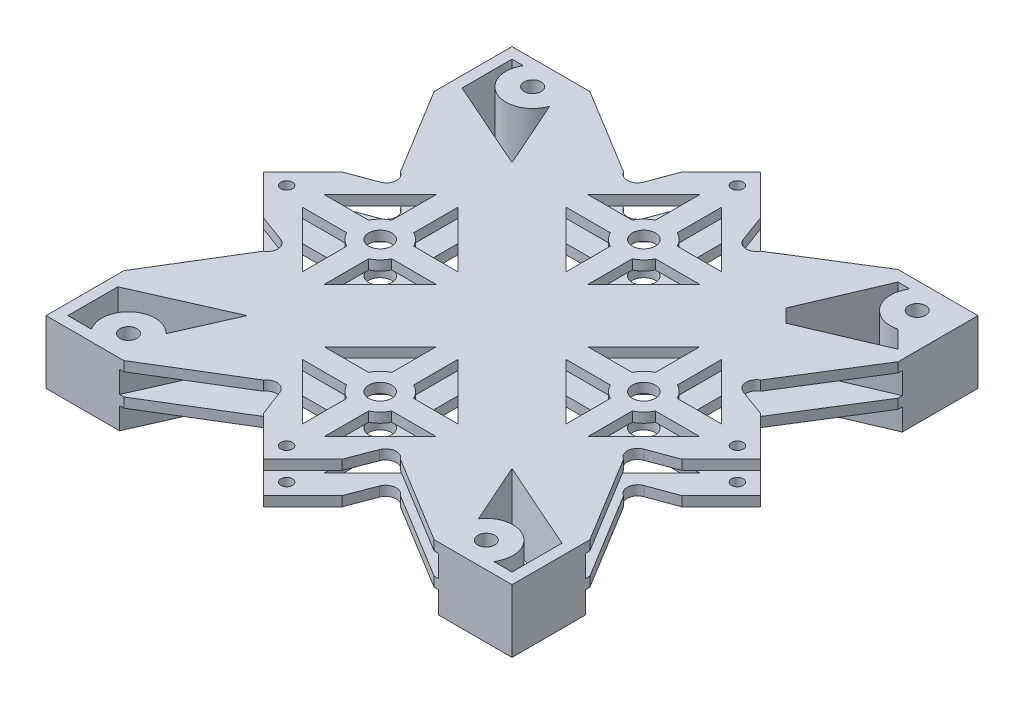
from build123d import *
from build123d.topology import SkipClean

# Parameters (mm, degrees)
SKETCH1_W            = 97.6
SKETCH1_H            = 97.6
BOSS_EXTRUDE1_DEPTH  = 2
SKETCH3_R            = 1.25
CUT_EXTRUDE1_DEPTH   = 10
FILLET1_R            = 0.2
SKETCH5_R            = 1.25
SKETCH5_R_2          = 1.248424064
SKETCH5_R_3          = 2.375
CUT_EXTRUDE2_DEPTH   = 10
SKETCH6_W            = 104.867444639
SKETCH6_H            = 104.070743389
SKETCH6_W_2          = 97.6
SKETCH6_H_2          = 97.6
BOSS_EXTRUDE2_DEPTH  = 2
SKETCH9_W            = 104.867444639
SKETCH9_H            = 104.070743389
CUT_EXTRUDE3_DEPTH   = 2
BOSS_EXTRUDE3_START  = 4.5
SKETCH11_R           = 1.25
BOSS_EXTRUDE3_DEPTH  = 4.5
CUT_EXTRUDE4_DEPTH   = 4.5
BOSS_EXTRUDE4_DEPTH  = 2
SKETCH15_R           = 1.25
SKETCH15_R_2         = 2.375
SKETCH15_R_3         = 1.248424064
CUT_EXTRUDE5_DEPTH   = 142.810069653
BOSS_EXTRUDE10_START = 4.5
SKETCH16_R           = 1.25
BOSS_EXTRUDE10_DEPTH = 4.5
CUT_EXTRUDE6_DEPTH   = 1.85
SKETCH18_R           = 1.75
CUT_EXTRUDE7_DEPTH   = 143.150785629
BOSS_EXTRUDE11_DEPTH = 13
CUT_EXTRUDE10_DEPTH  = 11
CUT_EXTRUDE11_DEPTH  = 11
BOSS_EXTRUDE13_DEPTH = 2
SKETCH33_W           = 24.159337572
SKETCH33_H           = 13.360853571
SKETCH33_W_2         = 23.642161886
SKETCH33_H_2         = 13
CUT_EXTRUDE13_DEPTH  = 0.75
SKETCH34_W           = 20.408967788
SKETCH34_H           = 13
SKETCH34_W_2         = 21.119256586
CUT_EXTRUDE14_DEPTH  = 0.75
SKETCH35_W           = 21.001738999
SKETCH35_H           = 13
SKETCH35_W_2         = 20.166168151
CUT_EXTRUDE15_DEPTH  = 0.75
SKETCH36_W           = 19.371210598
SKETCH36_H           = 13
SKETCH36_W_2         = 18.340258541
CUT_EXTRUDE16_DEPTH  = 0.75
SKETCH38_R           = 1.25
SKETCH38_R_2         = 1.248424064
BOSS_EXTRUDE14_DEPTH = 2
SKETCH39_R           = 1.25
SKETCH39_R_2         = 1.248424064
BOSS_EXTRUDE15_DEPTH = 2
SKETCH40_R           = 1.2
CUT_EXTRUDE17_DEPTH  = 142.810069653


with BuildPart() as part:
    # Sketch1 → Boss-Extrude1 (new body)
    with BuildSketch(Plane(origin=(0, 0, 0), x_dir=(1, 0, 0), z_dir=(0, 1, 0))):
        with Locations((48.8, 48.8)):
            Rectangle(SKETCH1_W, SKETCH1_H)
    extrude(amount=BOSS_EXTRUDE1_DEPTH)

    # Sketch3 → Cut-Extrude1 (cut)
    with BuildSketch(Plane.XZ):
        with BuildLine():
            Line((3, -84.3), (3, -94.6))
            Line((3, -94.6), (5.316079849, -94.6))
            ThreePointArc((5.316079849, -94.6), (7.792729855, -86.784550719), (15.285000001, -90.113353923))
            Line((15.285000001, -90.113353923), (21.472818771, -76.127181229))
            Line((21.472818771, -76.127181229), (3, -84.3))
        make_face()
        with BuildLine():
            Line((3, -13.3), (21.472818771, -21.472818771))
            Line((21.472818771, -21.472818771), (16.360495139, -9.917560959))
            ThreePointArc((16.360495139, -9.917560959), (8.975209709, -10.313312378), (7.873156109, -3))
            Line((7.873156109, -3), (3, -3))
            Line((3, -3), (3, -13.3))
        make_face()
        with BuildLine():
            Line((94.6, -13.3), (94.6, -3))
            Line((94.6, -3), (90.826843891, -3))
            ThreePointArc((90.826843891, -3), (89.267333256, -10.648445392), (81.630186258, -9.034513526))
            Line((81.630186258, -9.034513526), (76.127181229, -21.472818771))
            Line((76.127181229, -21.472818771), (94.6, -13.3))
        make_face()
        with BuildLine():
            Line((91.027327292, -86.172672708), (94.6, -82.6))
            Line((94.6, -82.6), (73.674141566, -73.674141566))
            Line((73.674141566, -73.674141566), (82.6, -94.6))
            Line((82.6, -94.6), (85.116873323, -94.6))
            ThreePointArc((85.116873323, -94.6), (85.157069093, -88.341897208), (91.027327292, -86.172672708))
        make_face()
        with Locations(Location((89.66, -91.5, 0), (0, 0, 270))):
            Circle(SKETCH3_R)
        with Locations(Location((10.05, -91.8, 0), (0, 0, 270))):
            Circle(SKETCH3_R)
        with Locations(Location((12.45, -6.05, 0), (0, 0, 270))):
            Circle(SKETCH3_R)
        with Locations(Location((86.25, -6.05, 0), (0, 0, 270))):
            Circle(SKETCH3_R)
    extrude(amount=-CUT_EXTRUDE1_DEPTH, mode=Mode.SUBTRACT)

    # Fillet1
    fillet1_edges = [part.edges().sort_by_distance(p)[0] for p in [
        (85.116873323, 1, -94.6),
    ]]
    fillet(fillet1_edges, radius=FILLET1_R)

    # Sketch5 → Cut-Extrude2 (cut)
    with BuildSketch(Plane.XZ):
        with BuildLine():
            Line((51.05, -80.617052601), (51.05, -89.767052601))
            Line((51.05, -89.767052601), (62.582493929, -78.234558673))
            Line((62.582493929, -78.234558673), (53.432493929, -78.234558673))
            ThreePointArc((53.432493929, -78.234558673), (52.441599923, -79.626158596), (51.05, -80.617052601))
        make_face()
        with BuildLine():
            Line((46.55, -89.767052601), (46.55, -80.617052601))
            ThreePointArc((46.55, -80.617052601), (45.158400077, -79.626158596), (44.167506071, -78.234558673))
            Line((44.167506071, -78.234558673), (35.017506071, -78.234558673))
            Line((35.017506071, -78.234558673), (46.55, -89.767052601))
        make_face()
        with BuildLine():
            Line((35.017506071, -73.734558673), (44.167506071, -73.734558673))
            ThreePointArc((44.167506071, -73.734558673), (45.158400077, -72.34295875), (46.55, -71.352064744))
            Line((46.55, -71.352064744), (46.55, -62.202064744))
            Line((46.55, -62.202064744), (35.017506071, -73.734558673))
        make_face()
        with BuildLine():
            ThreePointArc((51.05, -71.352064744), (52.441599923, -72.34295875), (53.432493929, -73.734558673))
            Line((53.432493929, -73.734558673), (62.582493929, -73.734558673))
            Line((62.582493929, -73.734558673), (51.05, -62.202064744))
            Line((51.05, -62.202064744), (51.05, -71.352064744))
        make_face()
        with BuildLine():
            Line((73.734558673, -35.017506071), (62.202064744, -46.55))
            Line((62.202064744, -46.55), (71.352064744, -46.55))
            ThreePointArc((71.352064744, -46.55), (72.34295875, -45.158400077), (73.734558673, -44.167506071))
            Line((73.734558673, -44.167506071), (73.734558673, -35.017506071))
        make_face()
        with BuildLine():
            ThreePointArc((73.734558673, -53.432493929), (72.34295875, -52.441599923), (71.352064744, -51.05))
            Line((71.352064744, -51.05), (62.202064744, -51.05))
            Line((62.202064744, -51.05), (73.734558673, -62.582493929))
            Line((73.734558673, -62.582493929), (73.734558673, -53.432493929))
        make_face()
        with BuildLine():
            Line((78.234558673, -35.017506071), (78.234558673, -44.167506071))
            ThreePointArc((78.234558673, -44.167506071), (79.626158596, -45.158400077), (80.617052601, -46.55))
            Line((80.617052601, -46.55), (89.767052601, -46.55))
            Line((89.767052601, -46.55), (78.234558673, -35.017506071))
        make_face()
        with BuildLine():
            ThreePointArc((80.617052601, -51.05), (79.626158596, -52.441599923), (78.234558673, -53.432493929))
            Line((78.234558673, -53.432493929), (78.234558673, -62.582493929))
            Line((78.234558673, -62.582493929), (89.767052601, -51.05))
            Line((89.767052601, -51.05), (80.617052601, -51.05))
        make_face()
        with BuildLine():
            Line((46.55, -16.982947399), (46.55, -7.832947399))
            Line((46.55, -7.832947399), (35.017506071, -19.365441327))
            Line((35.017506071, -19.365441327), (44.167506071, -19.365441327))
            ThreePointArc((44.167506071, -19.365441327), (45.158400077, -17.973841404), (46.55, -16.982947399))
        make_face()
        with BuildLine():
            Line((51.05, -7.832947399), (51.05, -16.982947399))
            ThreePointArc((51.05, -16.982947399), (52.441599923, -17.973841404), (53.432493929, -19.365441327))
            Line((53.432493929, -19.365441327), (62.582493929, -19.365441327))
            Line((62.582493929, -19.365441327), (51.05, -7.832947399))
        make_face()
        with BuildLine():
            ThreePointArc((46.55, -26.247935256), (45.158400077, -25.25704125), (44.167506071, -23.865441327))
            Line((44.167506071, -23.865441327), (35.017506071, -23.865441327))
            Line((35.017506071, -23.865441327), (46.55, -35.397935256))
            Line((46.55, -35.397935256), (46.55, -26.247935256))
        make_face()
        with BuildLine():
            Line((62.582493929, -23.865441327), (53.432493929, -23.865441327))
            ThreePointArc((53.432493929, -23.865441327), (52.441599923, -25.25704125), (51.05, -26.247935256))
            Line((51.05, -26.247935256), (51.05, -35.397935256))
            Line((51.05, -35.397935256), (62.582493929, -23.865441327))
        make_face()
        with BuildLine():
            Line((23.865441327, -62.582493929), (35.397935256, -51.05))
            Line((35.397935256, -51.05), (26.247935256, -51.05))
            ThreePointArc((26.247935256, -51.05), (25.25704125, -52.441599923), (23.865441327, -53.432493929))
            Line((23.865441327, -53.432493929), (23.865441327, -62.582493929))
        make_face()
        with BuildLine():
            Line((19.365441327, -62.582493929), (19.365441327, -53.432493929))
            ThreePointArc((19.365441327, -53.432493929), (17.973841404, -52.441599923), (16.982947399, -51.05))
            Line((16.982947399, -51.05), (7.832947399, -51.05))
            Line((7.832947399, -51.05), (19.365441327, -62.582493929))
        make_face()
        with BuildLine():
            ThreePointArc((23.865441327, -44.167506071), (25.25704125, -45.158400077), (26.247935256, -46.55))
            Line((26.247935256, -46.55), (35.397935256, -46.55))
            Line((35.397935256, -46.55), (23.865441327, -35.017506071))
            Line((23.865441327, -35.017506071), (23.865441327, -44.167506071))
        make_face()
        with BuildLine():
            Line((7.832947399, -46.55), (16.982947399, -46.55))
            ThreePointArc((16.982947399, -46.55), (17.973841404, -45.158400077), (19.365441327, -44.167506071))
            Line((19.365441327, -44.167506071), (19.365441327, -35.017506071))
            Line((19.365441327, -35.017506071), (7.832947399, -46.55))
        make_face()
        with Locations(Location((48.8, -95.854595373, 0), (0, 0, 270))):
            Circle(SKETCH5_R)
        with Locations(Location((95.84456992, -48.8, 0), (0, 0, 270))):
            Circle(SKETCH5_R_2)
        with Locations(Location((1.75, -48.8, 0), (0, 0, 270))):
            Circle(SKETCH5_R)
        with Locations(Location((48.8, -1.75, 0), (0, 0, 270))):
            Circle(SKETCH5_R)
        with Locations(Location((48.8, -75.984558673, 0), (0, 0, 270))):
            Circle(SKETCH5_R_3)
        with Locations(Location((75.984558673, -48.8, 0), (0, 0, 270))):
            Circle(SKETCH5_R_3)
        with Locations(Location((48.8, -21.615441327, 0), (0, 0, 270))):
            Circle(SKETCH5_R_3)
        with Locations(Location((21.615441327, -48.8, 0), (0, 0, 270))):
            Circle(SKETCH5_R_3)
    extrude(amount=-CUT_EXTRUDE2_DEPTH, mode=Mode.SUBTRACT)

    # Sketch6 → Boss-Extrude2 (add)
    with BuildSketch(Plane(origin=(0, 2, 0), x_dir=(1, 0, 0), z_dir=(0, 1, 0))):
        with Locations((49.842483603, 49.323375799)):
            Rectangle(SKETCH6_W, SKETCH6_H)
        with Locations((48.8, 48.8)):
            Rectangle(SKETCH6_W_2, SKETCH6_H_2, mode=Mode.SUBTRACT)
    extrude(amount=-BOSS_EXTRUDE2_DEPTH)

    # Sketch9 → Cut-Extrude3 (cut)
    # profile 1 of 9: a face of its own
    with BuildSketch(Plane(origin=(0, 2, 0), x_dir=(1, 0, 0), z_dir=(0, 1, 0))):
        with Locations((49.842483603, 49.323375799)):
            Rectangle(SKETCH9_W, SKETCH9_H)
        Polygon((81.575043976, 97.6), (97.6, 97.6), (97.6, 81.575043976), (97.6, 51.29456992), (100.09456992, 48.8), (97.6, 46.30543008), (97.6, 15.581273054), (97.6, 0), (82.018726946, 0), (51.29456992, 0), (48.8, -2.49456992), (46.30543008, 0), (15.581273054, 0), (0, 0), (0, 15.581273054), (0, 46.30543008), (-2.49456992, 48.8), (0, 51.29456992), (0, 82.018726946), (0, 97.6), (15.581273054, 97.6), (46.30543008, 97.6), (48.8, 100.09456992), (51.29456992, 97.6), align=None, mode=Mode.SUBTRACT)
    # profile 2 of 9: a face of its own
    with BuildSketch(Plane(origin=(0, 2, 0), x_dir=(1, 0, 0), z_dir=(0, 1, 0))):
        with BuildLine():
            Line((40.668272016, 91.962841937), (46.30543008, 97.6))
            Line((46.30543008, 97.6), (15.581273054, 97.6))
            Line((15.581273054, 97.6), (34.657864376, 85.952434296))
            ThreePointArc((34.657864376, 85.952434296), (36.694771141, 84.840299118), (38.55, 86.234558673))
            Line((38.55, 86.234558673), (40.668272016, 91.962841937))
        make_face()
    # profile 3 of 9: a face of its own
    with BuildSketch(Plane(origin=(0, 2, 0), x_dir=(1, 0, 0), z_dir=(0, 1, 0))):
        with BuildLine():
            Line((62.942135624, 85.952434296), (81.575043976, 97.6))
            Line((81.575043976, 97.6), (51.29456992, 97.6))
            Line((51.29456992, 97.6), (56.931727984, 91.962841937))
            Line((56.931727984, 91.962841937), (59.05, 86.234558673))
            ThreePointArc((59.05, 86.234558673), (60.905228859, 84.840299118), (62.942135624, 85.952434296))
        make_face()
    # profile 4 of 9: a face of its own
    with BuildSketch(Plane(origin=(0, 2, 0), x_dir=(1, 0, 0), z_dir=(0, 1, 0))):
        with BuildLine():
            Line((97.6, 51.29456992), (97.6, 81.575043976))
            Line((97.6, 81.575043976), (85.952434296, 62.942135624))
            ThreePointArc((85.952434296, 62.942135624), (84.840299118, 60.905228859), (86.234558673, 59.05))
            Line((86.234558673, 59.05), (91.962841937, 56.931727984))
            Line((91.962841937, 56.931727984), (97.6, 51.29456992))
        make_face()
    # profile 5 of 9: a face of its own
    with BuildSketch(Plane(origin=(0, 2, 0), x_dir=(1, 0, 0), z_dir=(0, 1, 0))):
        with BuildLine():
            Line((97.6, 15.581273054), (97.6, 46.30543008))
            Line((97.6, 46.30543008), (91.962841937, 40.668272016))
            Line((91.962841937, 40.668272016), (86.234558673, 38.55))
            ThreePointArc((86.234558673, 38.55), (84.840299118, 36.694771141), (85.952434296, 34.657864376))
            Line((85.952434296, 34.657864376), (97.6, 15.581273054))
        make_face()
    # profile 6 of 9: a face of its own
    with BuildSketch(Plane(origin=(0, 2, 0), x_dir=(1, 0, 0), z_dir=(0, 1, 0))):
        with BuildLine():
            Line((51.29456992, 0), (82.018726946, 0))
            Line((82.018726946, 0), (62.942135624, 11.647565704))
            ThreePointArc((62.942135624, 11.647565704), (60.858639354, 12.601902927), (59.05, 11.194586358))
            Line((59.05, 11.194586358), (56.931727984, 5.637158063))
            Line((56.931727984, 5.637158063), (51.29456992, 0))
        make_face()
    # profile 7 of 9: a face of its own
    with BuildSketch(Plane(origin=(0, 2, 0), x_dir=(1, 0, 0), z_dir=(0, 1, 0))):
        with BuildLine():
            Line((15.581273054, 0), (46.30543008, 0))
            Line((46.30543008, 0), (40.668272016, 5.637158063))
            Line((40.668272016, 5.637158063), (38.55, 11.194586358))
            ThreePointArc((38.55, 11.194586358), (36.741360646, 12.601902927), (34.657864376, 11.647565704))
            Line((34.657864376, 11.647565704), (15.581273054, 0))
        make_face()
    # profile 8 of 9: a face of its own
    with BuildSketch(Plane(origin=(0, 2, 0), x_dir=(1, 0, 0), z_dir=(0, 1, 0))):
        with BuildLine():
            Line((5.637158063, 40.668272016), (0, 46.30543008))
            Line((0, 46.30543008), (0, 15.581273054))
            Line((0, 15.581273054), (11.647565704, 34.657864376))
            ThreePointArc((11.647565704, 34.657864376), (12.759700882, 36.694771141), (11.365441327, 38.55))
            Line((11.365441327, 38.55), (5.637158063, 40.668272016))
        make_face()
    # profile 9 of 9: a face of its own
    with BuildSketch(Plane(origin=(0, 2, 0), x_dir=(1, 0, 0), z_dir=(0, 1, 0))):
        with BuildLine():
            Line((11.647565704, 62.942135624), (0, 82.018726946))
            Line((0, 82.018726946), (0, 51.29456992))
            Line((0, 51.29456992), (5.637158063, 56.931727984))
            Line((5.637158063, 56.931727984), (11.365441327, 59.05))
            ThreePointArc((11.365441327, 59.05), (12.759700882, 60.905228859), (11.647565704, 62.942135624))
        make_face()
    extrude(amount=-CUT_EXTRUDE3_DEPTH, mode=Mode.SUBTRACT)

    # Sketch11 → Boss-Extrude3 (add)
    # profile 1 of 9: a face of its own
    with SkipClean():  # the faces are left unmerged after this step: merging them gives an invalid solid
        with BuildSketch(Plane.XZ.offset(BOSS_EXTRUDE3_START)):
            Polygon((97.6, -97.6), (81.575043976, -97.6), (69.655336569, -69.655336569), (97.6, -81.575043976), align=None)
            with Locations(Location((89.66, -91.5, 0), (0, 0, 270))):
                Circle(SKETCH11_R, mode=Mode.SUBTRACT)
            with BuildLine():
                ThreePointArc((84.752862341, -94.6), (84.926573132, -94.499118926), (84.92504261, -94.298245614))
                ThreePointArc((84.92504261, -94.298245614), (85.26210654, -88.197193145), (91.027327292, -86.172672708))
                Line((91.027327292, -86.172672708), (94.6, -82.6))
                Line((94.6, -82.6), (73.674141566, -73.674141566))
                Line((73.674141566, -73.674141566), (82.6, -94.6))
                Line((82.6, -94.6), (84.752862341, -94.6))
            make_face(mode=Mode.SUBTRACT)
        # profile 2 of 9: a face of its own
        with BuildSketch(Plane.XZ.offset(BOSS_EXTRUDE3_START)):
            Polygon((48.8, -49.789949494), (47.810050506, -48.8), (26.169211238, -70.440839268), (27.944663431, -69.655336569), (27.159160732, -71.430788762), align=None)
        # profile 3 of 9: a face of its own
        with BuildSketch(Plane.XZ.offset(BOSS_EXTRUDE3_START)):
            Polygon((71.430788762, -27.159160732), (69.655336569, -27.944663431), (70.440839268, -26.169211238), (48.8, -47.810050506), (49.789949494, -48.8), align=None)
        # profile 4 of 9: a face of its own
        with BuildSketch(Plane.XZ.offset(BOSS_EXTRUDE3_START)):
            Polygon((47.810050506, -48.8), (48.8, -47.810050506), (27.159160732, -26.169211238), (27.944663431, -27.944663431), (26.169211238, -27.159160732), align=None)
        # profile 5 of 9: a face of its own
        with BuildSketch(Plane.XZ.offset(BOSS_EXTRUDE3_START)):
            Polygon((71.381631816, -70.391682322), (49.789949494, -48.8), (48.8, -49.789949494), (70.391682322, -71.381631816), (69.655336569, -69.655336569), align=None)
        # profile 6 of 9: a face of its own
        with BuildSketch(Plane.XZ.offset(BOSS_EXTRUDE3_START)):
            Polygon((49.789949494, -48.8), (48.8, -47.810050506), (47.810050506, -48.8), (48.8, -49.789949494), align=None)
        # profile 7 of 9: a face of its own
        with BuildSketch(Plane.XZ.offset(BOSS_EXTRUDE3_START)):
            Polygon((15.581273054, -97.6), (0, -97.6), (0, -82.018726946), (27.944663431, -69.655336569), align=None)
            with Locations(Location((10.05, -91.8, 0), (0, 0, 270))):
                Circle(SKETCH11_R, mode=Mode.SUBTRACT)
            with BuildLine():
                Line((21.472818771, -76.127181229), (15.285000001, -90.113353923))
                ThreePointArc((15.285000001, -90.113353923), (7.792729855, -86.784550719), (5.316079849, -94.6))
                Line((5.316079849, -94.6), (3, -94.6))
                Line((3, -94.6), (3, -84.3))
                Line((3, -84.3), (21.472818771, -76.127181229))
            make_face(mode=Mode.SUBTRACT)
        # profile 8 of 9: a face of its own
        with BuildSketch(Plane.XZ.offset(BOSS_EXTRUDE3_START)):
            Polygon((0, 0), (15.581273054, 0), (27.944663431, -27.944663431), (0, -15.581273054), align=None)
            with Locations(Location((12.45, -6.05, 0), (0, 0, 270))):
                Circle(SKETCH11_R, mode=Mode.SUBTRACT)
            with BuildLine():
                Line((3, -3), (7.873156109, -3))
                ThreePointArc((7.873156109, -3), (8.975209709, -10.313312378), (16.360495139, -9.917560959))
                Line((16.360495139, -9.917560959), (21.472818771, -21.472818771))
                Line((21.472818771, -21.472818771), (3, -13.3))
                Line((3, -13.3), (3, -3))
            make_face(mode=Mode.SUBTRACT)
        # profile 9 of 9: a face of its own
        with BuildSketch(Plane.XZ.offset(BOSS_EXTRUDE3_START)):
            Polygon((82.018726946, 0), (97.6, 0), (97.6, -15.581273054), (69.655336569, -27.944663431), align=None)
            with Locations(Location((86.25, -6.05, 0), (0, 0, 270))):
                Circle(SKETCH11_R, mode=Mode.SUBTRACT)
            with BuildLine():
                Line((76.127181229, -21.472818771), (81.630186258, -9.034513526))
                ThreePointArc((81.630186258, -9.034513526), (89.267333256, -10.648445392), (90.826843891, -3))
                Line((90.826843891, -3), (94.6, -3))
                Line((94.6, -3), (94.6, -13.3))
                Line((94.6, -13.3), (76.127181229, -21.472818771))
            make_face(mode=Mode.SUBTRACT)
        extrude(amount=-BOSS_EXTRUDE3_DEPTH)

    # Sketch12 → Cut-Extrude4 (cut)
    with SkipClean():  # the faces are left unmerged after this step: merging them gives an invalid solid
        with BuildSketch(Plane.XZ.offset(4.5)):
            Polygon((26.876318019, -71.14794605), (71.148273589, -26.875990479), (70.724009521, -26.451726411), (26.45205395, -70.723681981), align=None)
            Polygon((26.45205395, -26.876318019), (70.724009521, -71.148273589), (71.148273589, -70.724009521), (26.876318019, -26.45205395), align=None)
        extrude(amount=-CUT_EXTRUDE4_DEPTH, mode=Mode.SUBTRACT)

    # Sketch13 → Boss-Extrude4 (add)
    with SkipClean():  # the faces are left unmerged after this step: merging them gives an invalid solid
        with BuildSketch(Plane.XZ.offset(4.5)):
            with BuildLine():
                Line((0, -97.6), (0, -82.018726946))
                Line((0, -82.018726946), (11.647565704, -62.942135624))
                ThreePointArc((11.647565704, -62.942135624), (12.759700882, -60.905228859), (11.365441327, -59.05))
                Line((11.365441327, -59.05), (5.637158063, -56.931727984))
                Line((5.637158063, -56.931727984), (-2.49456992, -48.8))
                Line((-2.49456992, -48.8), (5.637158063, -40.668272016))
                Line((5.637158063, -40.668272016), (11.365441327, -38.55))
                ThreePointArc((11.365441327, -38.55), (12.759700882, -36.694771141), (11.647565704, -34.657864376))
                Line((11.647565704, -34.657864376), (0, -15.581273054))
                Line((0, -15.581273054), (0, 0))
                Line((0, 0), (15.581273054, 0))
                Line((15.581273054, 0), (34.657864376, -11.647565704))
                ThreePointArc((34.657864376, -11.647565704), (36.741360646, -12.601902927), (38.55, -11.194586358))
                Line((38.55, -11.194586358), (40.668272016, -5.637158063))
                Line((40.668272016, -5.637158063), (48.8, 2.49456992))
                Line((48.8, 2.49456992), (56.931727984, -5.637158063))
                Line((56.931727984, -5.637158063), (59.05, -11.194586358))
                ThreePointArc((59.05, -11.194586358), (60.858639354, -12.601902927), (62.942135624, -11.647565704))
                Line((62.942135624, -11.647565704), (82.018726946, 0))
                Line((82.018726946, 0), (97.6, 0))
                Line((97.6, 0), (97.6, -15.581273054))
                Line((97.6, -15.581273054), (85.952434296, -34.657864376))
                ThreePointArc((85.952434296, -34.657864376), (84.840299118, -36.694771141), (86.234558673, -38.55))
                Line((86.234558673, -38.55), (91.962841937, -40.668272016))
                Line((91.962841937, -40.668272016), (100.09456992, -48.8))
                Line((100.09456992, -48.8), (91.962841937, -56.931727984))
                Line((91.962841937, -56.931727984), (86.234558673, -59.05))
                ThreePointArc((86.234558673, -59.05), (84.840299118, -60.905228859), (85.952434296, -62.942135624))
                Line((85.952434296, -62.942135624), (97.6, -81.575043976))
                Line((97.6, -81.575043976), (97.6, -97.6))
                Line((97.6, -97.6), (81.575043976, -97.6))
                Line((81.575043976, -97.6), (62.942135624, -85.952434296))
                ThreePointArc((62.942135624, -85.952434296), (60.905228859, -84.840299118), (59.05, -86.234558673))
                Line((59.05, -86.234558673), (56.931727984, -91.962841937))
                Line((56.931727984, -91.962841937), (48.8, -100.09456992))
                Line((48.8, -100.09456992), (40.668272016, -91.962841937))
                Line((40.668272016, -91.962841937), (38.55, -86.234558673))
                ThreePointArc((38.55, -86.234558673), (36.694771141, -84.840299118), (34.657864376, -85.952434296))
                Line((34.657864376, -85.952434296), (15.581273054, -97.6))
                Line((15.581273054, -97.6), (0, -97.6))
            make_face()
        extrude(amount=BOSS_EXTRUDE4_DEPTH)

    # Sketch15 → Cut-Extrude5 (cut, through all)
    with SkipClean():  # the faces are left unmerged after this step: merging them gives an invalid solid
        with BuildSketch(Plane.XZ.offset(6.5)):
            with BuildLine():
                ThreePointArc((53.432493929, -73.734558673), (52.441599923, -72.34295875), (51.05, -71.352064744))
                Line((51.05, -71.352064744), (51.05, -62.202064744))
                Line((51.05, -62.202064744), (62.582493929, -73.734558673))
                Line((62.582493929, -73.734558673), (53.432493929, -73.734558673))
            make_face()
            with BuildLine():
                ThreePointArc((51.05, -80.617052601), (52.441599923, -79.626158596), (53.432493929, -78.234558673))
                Line((53.432493929, -78.234558673), (62.582493929, -78.234558673))
                Line((62.582493929, -78.234558673), (51.05, -89.767052601))
                Line((51.05, -89.767052601), (51.05, -80.617052601))
            make_face()
            with BuildLine():
                ThreePointArc((44.167506071, -78.234558673), (45.158400077, -79.626158596), (46.55, -80.617052601))
                Line((46.55, -80.617052601), (46.55, -89.767052601))
                Line((46.55, -89.767052601), (35.017506071, -78.234558673))
                Line((35.017506071, -78.234558673), (44.167506071, -78.234558673))
            make_face()
            with BuildLine():
                ThreePointArc((46.55, -71.352064744), (45.158400077, -72.34295875), (44.167506071, -73.734558673))
                Line((44.167506071, -73.734558673), (35.017506071, -73.734558673))
                Line((35.017506071, -73.734558673), (46.55, -62.202064744))
                Line((46.55, -62.202064744), (46.55, -71.352064744))
            make_face()
            with BuildLine():
                ThreePointArc((15.285000001, -90.113353923), (7.792729855, -86.784550719), (5.316079849, -94.6))
                Line((5.316079849, -94.6), (3, -94.6))
                Line((3, -94.6), (3, -84.3))
                Line((3, -84.3), (21.472818771, -76.127181229))
                Line((21.472818771, -76.127181229), (15.285000001, -90.113353923))
            make_face()
            with Locations(Location((10.05, -91.8, 0), (0, 0, 270))):
                Circle(SKETCH15_R)
            with BuildLine():
                ThreePointArc((16.982947399, -51.05), (17.973841404, -52.441599923), (19.365441327, -53.432493929))
                Line((19.365441327, -53.432493929), (19.365441327, -62.582493929))
                Line((19.365441327, -62.582493929), (7.832947399, -51.05))
                Line((7.832947399, -51.05), (16.982947399, -51.05))
            make_face()
            with BuildLine():
                ThreePointArc((19.365441327, -44.167506071), (17.973841404, -45.158400077), (16.982947399, -46.55))
                Line((16.982947399, -46.55), (7.832947399, -46.55))
                Line((7.832947399, -46.55), (19.365441327, -35.017506071))
                Line((19.365441327, -35.017506071), (19.365441327, -44.167506071))
            make_face()
            with BuildLine():
                ThreePointArc((26.247935256, -46.55), (25.25704125, -45.158400077), (23.865441327, -44.167506071))
                Line((23.865441327, -44.167506071), (23.865441327, -35.017506071))
                Line((23.865441327, -35.017506071), (35.397935256, -46.55))
                Line((35.397935256, -46.55), (26.247935256, -46.55))
            make_face()
            with BuildLine():
                ThreePointArc((23.865441327, -53.432493929), (25.25704125, -52.441599923), (26.247935256, -51.05))
                Line((26.247935256, -51.05), (35.397935256, -51.05))
                Line((35.397935256, -51.05), (23.865441327, -62.582493929))
                Line((23.865441327, -62.582493929), (23.865441327, -53.432493929))
            make_face()
            with Locations(Location((21.615441327, -48.8, 0), (0, 0, 270))):
                Circle(SKETCH15_R_2)
            with Locations(Location((1.75, -48.8, 0), (0, 0, 270))):
                Circle(SKETCH15_R)
            with BuildLine():
                ThreePointArc((7.873156109, -3), (8.975209709, -10.313312378), (16.360495139, -9.917560959))
                Line((16.360495139, -9.917560959), (21.472818771, -21.472818771))
                Line((21.472818771, -21.472818771), (3, -13.3))
                Line((3, -13.3), (3, -3))
                Line((3, -3), (7.873156109, -3))
            make_face()
            with Locations(Location((12.45, -6.05, 0), (0, 0, 270))):
                Circle(SKETCH15_R)
            with BuildLine():
                ThreePointArc((71.352064744, -51.05), (72.34295875, -52.441599923), (73.734558673, -53.432493929))
                Line((73.734558673, -53.432493929), (73.734558673, -62.582493929))
                Line((73.734558673, -62.582493929), (62.202064744, -51.05))
                Line((62.202064744, -51.05), (71.352064744, -51.05))
            make_face()
            with BuildLine():
                ThreePointArc((78.234558673, -53.432493929), (79.626158596, -52.441599923), (80.617052601, -51.05))
                Line((80.617052601, -51.05), (89.767052601, -51.05))
                Line((89.767052601, -51.05), (78.234558673, -62.582493929))
                Line((78.234558673, -62.582493929), (78.234558673, -53.432493929))
            make_face()
            with BuildLine():
                ThreePointArc((73.734558673, -44.167506071), (72.34295875, -45.158400077), (71.352064744, -46.55))
                Line((71.352064744, -46.55), (62.202064744, -46.55))
                Line((62.202064744, -46.55), (73.734558673, -35.017506071))
                Line((73.734558673, -35.017506071), (73.734558673, -44.167506071))
            make_face()
            with BuildLine():
                ThreePointArc((80.617052601, -46.55), (79.626158596, -45.158400077), (78.234558673, -44.167506071))
                Line((78.234558673, -44.167506071), (78.234558673, -35.017506071))
                Line((78.234558673, -35.017506071), (89.767052601, -46.55))
                Line((89.767052601, -46.55), (80.617052601, -46.55))
            make_face()
            with Locations(Location((89.66, -91.5, 0), (0, 0, 270))):
                Circle(SKETCH15_R)
            with BuildLine():
                ThreePointArc((81.630186258, -9.034513526), (89.267333256, -10.648445392), (90.826843891, -3))
                Line((90.826843891, -3), (94.6, -3))
                Line((94.6, -3), (94.6, -13.3))
                Line((94.6, -13.3), (76.127181229, -21.472818771))
                Line((76.127181229, -21.472818771), (81.630186258, -9.034513526))
            make_face()
            with BuildLine():
                ThreePointArc((51.05, -26.247935256), (52.441599923, -25.25704125), (53.432493929, -23.865441327))
                Line((53.432493929, -23.865441327), (62.582493929, -23.865441327))
                Line((62.582493929, -23.865441327), (51.05, -35.397935256))
                Line((51.05, -35.397935256), (51.05, -26.247935256))
            make_face()
            with BuildLine():
                ThreePointArc((53.432493929, -19.365441327), (52.441599923, -17.973841404), (51.05, -16.982947399))
                Line((51.05, -16.982947399), (51.05, -7.832947399))
                Line((51.05, -7.832947399), (62.582493929, -19.365441327))
                Line((62.582493929, -19.365441327), (53.432493929, -19.365441327))
            make_face()
            with BuildLine():
                ThreePointArc((44.167506071, -23.865441327), (45.158400077, -25.25704125), (46.55, -26.247935256))
                Line((46.55, -26.247935256), (46.55, -35.397935256))
                Line((46.55, -35.397935256), (35.017506071, -23.865441327))
                Line((35.017506071, -23.865441327), (44.167506071, -23.865441327))
            make_face()
            with BuildLine():
                ThreePointArc((46.55, -16.982947399), (45.158400077, -17.973841404), (44.167506071, -19.365441327))
                Line((44.167506071, -19.365441327), (35.017506071, -19.365441327))
                Line((35.017506071, -19.365441327), (46.55, -7.832947399))
                Line((46.55, -7.832947399), (46.55, -16.982947399))
            make_face()
            with Locations(Location((48.8, -21.615441327, 0), (0, 0, 270))):
                Circle(SKETCH15_R_2)
            with Locations(Location((48.8, -75.984558673, 0), (0, 0, 270))):
                Circle(SKETCH15_R_2)
            with Locations(Location((48.8, -95.854595373, 0), (0, 0, 270))):
                Circle(SKETCH15_R)
            with Locations(Location((95.84456992, -48.8, 0), (0, 0, 270))):
                Circle(SKETCH15_R_3)
            with Locations(Location((48.8, -1.75, 0), (0, 0, 270))):
                Circle(SKETCH15_R)
            with Locations(Location((75.984558673, -48.8, 0), (0, 0, 270))):
                Circle(SKETCH15_R_2)
            with Locations(Location((86.25, -6.05, 0), (0, 0, 270))):
                Circle(SKETCH15_R)
            with BuildLine():
                Line((82.6, -94.6), (84.752862341, -94.6))
                ThreePointArc((84.752862341, -94.6), (84.926573132, -94.499118926), (84.92504261, -94.298245614))
                ThreePointArc((84.92504261, -94.298245614), (85.26210654, -88.197193145), (91.027327292, -86.172672708))
                Line((91.027327292, -86.172672708), (94.6, -82.6))
                Line((94.6, -82.6), (73.674141566, -73.674141566))
                Line((73.674141566, -73.674141566), (82.6, -94.6))
            make_face()
        extrude(amount=-CUT_EXTRUDE5_DEPTH, mode=Mode.SUBTRACT)

    # Sketch16 → Boss-Extrude10 (add)
    with SkipClean():  # the faces are left unmerged after this step: merging them gives an invalid solid
        with BuildSketch(Plane.XZ.offset(6.5).offset(BOSS_EXTRUDE10_START)):
            Polygon((0, 0), (0, -15.581273054), (26.169211238, -27.159160732), (47.810050506, -48.8), (26.169211238, -70.440839268), (0, -82.018726946), (0, -97.6), (15.581273054, -97.6), (27.159160732, -71.430788762), (48.8, -49.789949494), (70.391682322, -71.381631816), (81.575043976, -97.6), (97.6, -97.6), (97.6, -81.575043976), (71.381631816, -70.391682322), (49.789949494, -48.8), (71.430788762, -27.159160732), (97.6, -15.581273054), (97.6, 0), (82.018726946, 0), (70.440839268, -26.169211238), (48.8, -47.810050506), (27.159160732, -26.169211238), (15.581273054, 0), align=None)
            with BuildLine():
                Line((21.472818771, -21.472818771), (3, -13.3))
                Line((3, -13.3), (3, -3))
                Line((3, -3), (7.873156109, -3))
                ThreePointArc((7.873156109, -3), (8.975209709, -10.313312378), (16.360495139, -9.917560959))
                Line((16.360495139, -9.917560959), (21.472818771, -21.472818771))
            make_face(mode=Mode.SUBTRACT)
            with Locations(Location((12.45, -6.05, 0), (0, 0, 270))):
                Circle(SKETCH16_R, mode=Mode.SUBTRACT)
            with BuildLine():
                Line((21.472818771, -76.127181229), (15.285000001, -90.113353923))
                ThreePointArc((15.285000001, -90.113353923), (7.792729855, -86.784550719), (5.316079849, -94.6))
                Line((5.316079849, -94.6), (3, -94.6))
                Line((3, -94.6), (3, -84.3))
                Line((3, -84.3), (21.472818771, -76.127181229))
            make_face(mode=Mode.SUBTRACT)
            with Locations(Location((10.05, -91.8, 0), (0, 0, 270))):
                Circle(SKETCH16_R, mode=Mode.SUBTRACT)
            with BuildLine():
                Line((94.6, -82.6), (91.027327292, -86.172672708))
                ThreePointArc((91.027327292, -86.172672708), (85.26210654, -88.197193145), (84.92504261, -94.298245614))
                ThreePointArc((84.92504261, -94.298245614), (84.926573132, -94.499118926), (84.752862341, -94.6))
                Line((84.752862341, -94.6), (82.6, -94.6))
                Line((82.6, -94.6), (73.674141566, -73.674141566))
                Line((73.674141566, -73.674141566), (94.6, -82.6))
            make_face(mode=Mode.SUBTRACT)
            with Locations(Location((89.66, -91.5, 0), (0, 0, 270))):
                Circle(SKETCH16_R, mode=Mode.SUBTRACT)
            with Locations(Location((86.25, -6.05, 0), (0, 0, 270))):
                Circle(SKETCH16_R, mode=Mode.SUBTRACT)
            with BuildLine():
                Line((76.127181229, -21.472818771), (81.630186258, -9.034513526))
                ThreePointArc((81.630186258, -9.034513526), (89.267333256, -10.648445392), (90.826843891, -3))
                Line((90.826843891, -3), (94.6, -3))
                Line((94.6, -3), (94.6, -13.3))
                Line((94.6, -13.3), (76.127181229, -21.472818771))
            make_face(mode=Mode.SUBTRACT)
        extrude(amount=-BOSS_EXTRUDE10_DEPTH)

    # Sketch17 → Cut-Extrude6 (cut)
    with SkipClean():  # the faces are left unmerged after this step: merging them gives an invalid solid
        with BuildSketch(Plane.XZ.offset(11)):
            Polygon((26.45205395, -70.723681981), (26.876318019, -71.14794605), (48.8, -49.224264069), (48.375735931, -48.8), align=None)
            Polygon((26.45205395, -26.876318019), (48.375735931, -48.8), (48.8, -48.375735931), (26.876318019, -26.45205395), align=None)
            Polygon((48.8, -48.375735931), (49.224264069, -48.8), (71.148273589, -26.875990479), (70.724009521, -26.451726411), align=None)
            Polygon((48.375735931, -48.8), (48.8, -49.224264069), (49.224264069, -48.8), (48.8, -48.375735931), align=None)
            Polygon((49.224264069, -48.8), (48.8, -49.224264069), (70.724009521, -71.148273589), (71.148273589, -70.724009521), align=None)
        extrude(amount=-CUT_EXTRUDE6_DEPTH, mode=Mode.SUBTRACT)

    # Sketch18 → Cut-Extrude7 (cut, through all)
    with SkipClean():  # the faces are left unmerged after this step: merging them gives an invalid solid
        with BuildSketch(Plane.XZ.offset(11)):
            with Locations(Location((12.45, -6.05, 0), (0, 0, 270))):
                Circle(SKETCH18_R)
            with Locations(Location((86.25, -6.05, 0), (0, 0, 270))):
                Circle(SKETCH18_R)
            with Locations(Location((10.05, -91.8, 0), (0, 0, 270))):
                Circle(SKETCH18_R)
            with Locations(Location((89.66, -91.5, 0), (0, 0, 270))):
                Circle(SKETCH18_R)
        extrude(amount=-CUT_EXTRUDE7_DEPTH, mode=Mode.SUBTRACT)

    # Sketch20 → Boss-Extrude11 (add)
    with SkipClean():  # the faces are left unmerged after this step: merging them gives an invalid solid
        with BuildSketch(Plane.XZ.offset(11)):
            Polygon((78.43455017, -75.704678732), (75.704678732, -78.43455017), (73.674141566, -73.674141566), align=None)
        extrude(amount=-BOSS_EXTRUDE11_DEPTH)

    # Sketch19 → Cut-Extrude10 (cut)
    with SkipClean():  # the faces are left unmerged after this step: merging them gives an invalid solid
        with BuildSketch(Plane.XZ.offset(11)):
            Polygon((76.528651212, -24.903743925), (72.116660746, -26.85571449), (75.298641261, -23.673733975), align=None)
            Polygon((75.10742839, -23.482521103), (71.430788762, -27.159160732), (72.116660746, -26.85571449), (75.298641261, -23.673733975), align=None)
            Polygon((70.74428551, -25.483339254), (73.926266025, -22.301358739), (72.696256075, -21.071348788), align=None)
            Polygon((70.440839268, -26.169211238), (74.117478897, -22.49257161), (73.926266025, -22.301358739), (70.74428551, -25.483339254), align=None)
            Polygon((24.903743925, -21.071348788), (26.85571449, -25.483339254), (23.673733975, -22.301358739), align=None)
            Polygon((23.482521103, -22.49257161), (27.159160732, -26.169211238), (26.85571449, -25.483339254), (23.673733975, -22.301358739), align=None)
            Polygon((26.169211238, -27.159160732), (22.49257161, -23.482521103), (22.301358739, -23.673733975), (25.483339254, -26.85571449), align=None)
            Polygon((21.071348788, -24.903743925), (25.483339254, -26.85571449), (22.301358739, -23.673733975), align=None)
            Polygon((21.071348788, -72.696256075), (25.483339254, -70.74428551), (22.301358739, -73.926266025), align=None)
            Polygon((22.301358739, -73.926266025), (22.49257161, -74.117478897), (26.169211238, -70.440839268), (25.483339254, -70.74428551), align=None)
            Polygon((26.85571449, -72.116660746), (27.159160732, -71.430788762), (23.482521103, -75.10742839), (23.673733975, -75.298641261), align=None)
            Polygon((23.673733975, -75.298641261), (24.903743925, -76.528651212), (26.85571449, -72.116660746), align=None)
            Polygon((72.58880733, -76.532590373), (70.685941391, -72.071495281), (73.867921907, -75.253475796), align=None)
            Polygon((75.253475796, -73.867921907), (76.532590373, -72.58880733), (72.071495281, -70.685941391), align=None)
            Polygon((72.071495281, -70.685941391), (71.381631816, -70.391682322), (75.055673598, -74.065724105), (75.253475796, -73.867921907), align=None)
            Polygon((73.867921907, -75.253475796), (74.065724105, -75.055673598), (70.391682322, -71.381631816), (70.685941391, -72.071495281), align=None)
        extrude(amount=-CUT_EXTRUDE10_DEPTH, mode=Mode.SUBTRACT)

    # Sketch21 → Cut-Extrude11 (cut)
    with SkipClean():  # the faces are left unmerged after this step: merging them gives an invalid solid
        with BuildSketch(Plane.XZ.offset(11)):
            Polygon((76.528651212, -24.903743925), (75.10742839, -23.482521103), (79.741005768, -23.482521103), align=None)
            Polygon((72.696256075, -21.071348788), (74.117478897, -22.49257161), (74.117478897, -17.858994232), align=None)
            Polygon((17.858994232, -74.117478897), (21.071348788, -72.696256075), (22.49257161, -74.117478897), align=None)
            Polygon((23.482521103, -79.741005768), (24.903743925, -76.528651212), (23.482521103, -75.10742839), align=None)
            Polygon((72.58880733, -76.532590373), (74.065724105, -75.055673598), (74.065724105, -79.995086621), align=None)
            Polygon((79.995086621, -74.065724105), (76.532590373, -72.58880733), (75.055673598, -74.065724105), align=None)
            Polygon((23.482521103, -22.49257161), (23.482521103, -17.858994232), (24.903743925, -21.071348788), align=None)
            Polygon((17.858994232, -23.482521103), (21.071348788, -24.903743925), (22.49257161, -23.482521103), align=None)
        extrude(amount=-CUT_EXTRUDE11_DEPTH, mode=Mode.SUBTRACT)

    # Sketch31 → Boss-Extrude13 (add)
    with SkipClean():  # the faces are left unmerged after this step: merging them gives an invalid solid
        with BuildSketch(Plane.XZ.offset(6.5)):
            Polygon((26.169211238, -27.159160732), (17.858994232, -23.482521103), (22.49257161, -23.482521103), align=None)
            Polygon((27.159160732, -26.169211238), (23.482521103, -17.858994232), (23.482521103, -22.49257161), align=None)
            Polygon((70.440839268, -26.169211238), (74.117478897, -22.49257161), (74.117478897, -17.858994232), align=None)
            Polygon((71.430788762, -27.159160732), (79.741005768, -23.482521103), (75.10742839, -23.482521103), align=None)
            Polygon((74.065724105, -79.995086621), (74.065724105, -75.055673598), (70.391682322, -71.381631816), align=None)
            Polygon((79.995086621, -74.065724105), (71.381631816, -70.391682322), (75.055673598, -74.065724105), align=None)
            Polygon((23.482521103, -79.741005768), (23.482521103, -75.10742839), (27.159160732, -71.430788762), align=None)
            Polygon((17.858994232, -74.117478897), (26.169211238, -70.440839268), (22.49257161, -74.117478897), align=None)
        extrude(amount=-BOSS_EXTRUDE13_DEPTH)

    # Sketch33 → Cut-Extrude13 (cut)
    with SkipClean():  # the faces are left unmerged after this step: merging them gives an invalid solid
        with BuildSketch(Plane(origin=(97.6, 0, 0), x_dir=(0, 0, -1), z_dir=(1, 0, 0))):
            with Locations((85.520331214, -4.319573215)):
                Rectangle(SKETCH33_W, SKETCH33_H)
            with Locations((11.821080943, -4.5)):
                Rectangle(SKETCH33_W_2, SKETCH33_H_2)
        extrude(amount=-CUT_EXTRUDE13_DEPTH, mode=Mode.SUBTRACT)

    # Sketch34 → Cut-Extrude14 (cut)
    with SkipClean():  # the faces are left unmerged after this step: merging them gives an invalid solid
        with BuildSketch(Plane(origin=(0, 0, -97.6), x_dir=(-1, 0, 0), z_dir=(0, 0, -1))):
            with Locations((-10.204483894, -4.5)):
                Rectangle(SKETCH34_W, SKETCH34_H)
            with Locations((-86.290371707, -4.5)):
                Rectangle(SKETCH34_W_2, SKETCH34_H)
        extrude(amount=-CUT_EXTRUDE14_DEPTH, mode=Mode.SUBTRACT)

    # Sketch35 → Cut-Extrude15 (cut)
    with SkipClean():  # the faces are left unmerged after this step: merging them gives an invalid solid
        with BuildSketch(Plane.ZY):
            with Locations((-86.349130501, -4.5)):
                Rectangle(SKETCH35_W, SKETCH35_H)
            with Locations((-10.083084076, -4.5)):
                Rectangle(SKETCH35_W_2, SKETCH35_H)
        extrude(amount=-CUT_EXTRUDE15_DEPTH, mode=Mode.SUBTRACT)

    # Sketch36 → Cut-Extrude16 (cut)
    with SkipClean():  # the faces are left unmerged after this step: merging them gives an invalid solid
        with BuildSketch(Plane.XY):
            with Locations((87.164394701, -4.5)):
                Rectangle(SKETCH36_W, SKETCH36_H)
            with Locations((9.920129271, -4.5)):
                Rectangle(SKETCH36_W_2, SKETCH36_H)
        extrude(amount=-CUT_EXTRUDE16_DEPTH, mode=Mode.SUBTRACT)

    # Sketch38 → Boss-Extrude14 (add)
    with SkipClean():  # the faces are left unmerged after this step: merging them gives an invalid solid
        with BuildSketch(Plane.XZ.offset(6.5)):
            with Locations(Location((48.8, -95.854595373, 0), (0, 0, 270))):
                Circle(SKETCH38_R)
            with Locations(Location((95.84456992, -48.8, 0), (0, 0, 270))):
                Circle(SKETCH38_R_2)
            with Locations(Location((48.8, -1.75, 0), (0, 0, 270))):
                Circle(SKETCH38_R)
            with Locations(Location((1.75, -48.8, 0), (0, 0, 270))):
                Circle(SKETCH38_R)
        extrude(amount=-BOSS_EXTRUDE14_DEPTH)

    # Sketch39 → Boss-Extrude15 (add)
    with SkipClean():  # the faces are left unmerged after this step: merging them gives an invalid solid
        with BuildSketch(Plane.XZ):
            with Locations((48.8, -1.75)):
                Circle(SKETCH39_R)
            with Locations((95.84456992, -48.8)):
                Circle(SKETCH39_R_2)
            with Locations((1.75, -48.8)):
                Circle(SKETCH39_R)
            with Locations((48.8, -95.854595373)):
                Circle(SKETCH39_R)
        extrude(amount=-BOSS_EXTRUDE15_DEPTH)

    # Sketch40 → Cut-Extrude17 (cut, through all)
    with SkipClean():  # the faces are left unmerged after this step: merging them gives an invalid solid
        with BuildSketch(Plane.XZ.offset(6.5)):
            with Locations(Location((2.32375, -48.8, 0), (0, 0, 270))):
                Circle(SKETCH40_R)
            with Locations(Location((95.27625, -48.8, 0), (0, 0, 270))):
                Circle(SKETCH40_R)
            with Locations(Location((48.8, -2.32375, 0), (0, 0, 270))):
                Circle(SKETCH40_R)
            with Locations(Location((48.8, -95.27625, 0), (0, 0, 270))):
                Circle(SKETCH40_R)
        extrude(amount=-CUT_EXTRUDE17_DEPTH, mode=Mode.SUBTRACT)


solid = part.part
